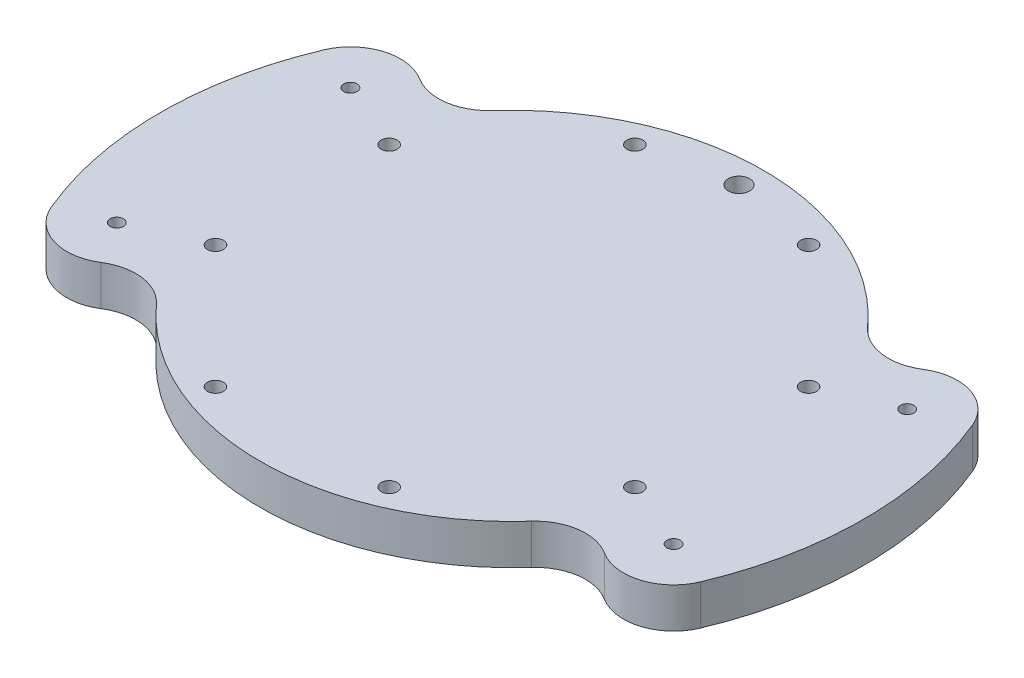
from build123d import *

# Parameters (mm, degrees)
SKETCH1_R                                       = 1
BOSS_EXTRUDE1_DEPTH                             = 6
FILLET1_R                                       = 7.5
SKETCH2_R                                       = 1.6
CUT_EXTRUDE1_DEPTH                              = 66.108380797
CSK_FOR_M2_FLAT_HEAD_MACHINE_SCREW1_D           = 2.4
CSK_FOR_M2_FLAT_HEAD_MACHINE_SCREW1_CSINK_D     = 4.4
CSK_FOR_M2_FLAT_HEAD_MACHINE_SCREW1_CSINK_ANGLE = 90


with BuildPart() as part:
    # Sketch1 → Boss-Extrude1 (new body)
    with BuildSketch(Plane(origin=(0, 0, 0), x_dir=(1, 0, 0), z_dir=(0, 1, 0))):
        with BuildLine():
            Line((31.883633055, 20.164562188), (44.561021943, 28.182280752))
            ThreePointArc((44.561021943, 28.182280752), (52.725, 0), (44.561021943, -28.182280752))
            Line((44.561021943, -28.182280752), (31.883633055, -20.164562188))
            ThreePointArc((31.883633055, -20.164562188), (0, -37.725), (-31.883633055, -20.164562188))
            Line((-31.883633055, -20.164562188), (-44.561021943, -28.182280752))
            ThreePointArc((-44.561021943, -28.182280752), (-52.725, 0), (-44.561021943, 28.182280752))
            Line((-44.561021943, 28.182280752), (-31.883633055, 20.164562188))
            ThreePointArc((-31.883633055, 20.164562188), (0, 37.725), (31.883633055, 20.164562188))
        make_face()
        with Locations(Location((-13.0112367, 31.411904105, 0), (0, 0, 270))):
            Circle(SKETCH1_R, mode=Mode.SUBTRACT)
        with Locations(Location((13.0112367, 31.411904105, 0), (0, 0, 270))):
            Circle(SKETCH1_R, mode=Mode.SUBTRACT)
        with Locations(Location((31.411904105, 13.0112367, 0), (0, 0, 270))):
            Circle(SKETCH1_R, mode=Mode.SUBTRACT)
        with Locations(Location((31.411904105, -13.0112367, 0), (0, 0, 270))):
            Circle(SKETCH1_R, mode=Mode.SUBTRACT)
        with Locations(Location((13.0112367, -31.411904105, 0), (0, 0, 270))):
            Circle(SKETCH1_R, mode=Mode.SUBTRACT)
        with Locations(Location((-13.0112367, -31.411904105, 0), (0, 0, 270))):
            Circle(SKETCH1_R, mode=Mode.SUBTRACT)
        with Locations(Location((-31.411904105, -13.0112367, 0), (0, 0, 270))):
            Circle(SKETCH1_R, mode=Mode.SUBTRACT)
        with Locations(Location((-31.411904105, 13.0112367, 0), (0, 0, 270))):
            Circle(SKETCH1_R, mode=Mode.SUBTRACT)
        with Locations(Location((41.701925915, 17.5, 0), (0, 0, 270))):
            Circle(SKETCH1_R, mode=Mode.SUBTRACT)
        with Locations(Location((41.701925915, -17.5, 0), (0, 0, 270))):
            Circle(SKETCH1_R, mode=Mode.SUBTRACT)
        with Locations(Location((-41.701925915, 17.5, 0), (0, 0, 90))):
            Circle(SKETCH1_R, mode=Mode.SUBTRACT)
        with Locations(Location((-41.701925915, -17.5, 0), (0, 0, 90))):
            Circle(SKETCH1_R, mode=Mode.SUBTRACT)
    extrude(amount=BOSS_EXTRUDE1_DEPTH)

    # Fillet1
    fillet1_edges = [part.edges().sort_by_distance(p)[0] for p in [
        (44.561021943, 3, 28.182280752),
        (31.883633055, 3, 20.164562188),
        (-44.561021943, 3, 28.182280752),
        (-31.883633055, 3, 20.164562188),
        (44.561021943, 3, -28.182280752),
        (31.883633055, 3, -20.164562188),
        (-44.561021943, 3, -28.182280752),
        (-31.883633055, 3, -20.164562188),
    ]]
    fillet(fillet1_edges, radius=FILLET1_R - 0.0001)  # a hair under: the kernel refuses the full size

    # Sketch2 → Cut-Extrude1 (cut, through all)
    with BuildSketch(Plane(origin=(0, 6, 0), x_dir=(1, 0, 0), z_dir=(0, 1, 0))):
        with Locations(Location((0, 34, 0), (0, 0, 270))):
            Circle(SKETCH2_R)
    extrude(amount=-CUT_EXTRUDE1_DEPTH, mode=Mode.SUBTRACT)

    # CSK for M2 Flat Head Machine Screw1 (through all)
    with Locations(Plane(origin=(0, 0, 0), x_dir=(-1, 0, 0), z_dir=(0, -1, 0))):
        with Locations((13.0112367, -31.411904105), (-13.0112367, -31.411904105), (-31.411904105, -13.0112367), (-31.411904105, 13.0112367), (-13.0112367, 31.411904105), (13.0112367, 31.411904105), (31.411904105, 13.0112367), (31.411904105, -13.0112367)):
            CounterSinkHole(CSK_FOR_M2_FLAT_HEAD_MACHINE_SCREW1_D / 2, CSK_FOR_M2_FLAT_HEAD_MACHINE_SCREW1_CSINK_D / 2, counter_sink_angle=CSK_FOR_M2_FLAT_HEAD_MACHINE_SCREW1_CSINK_ANGLE)


solid = part.part
